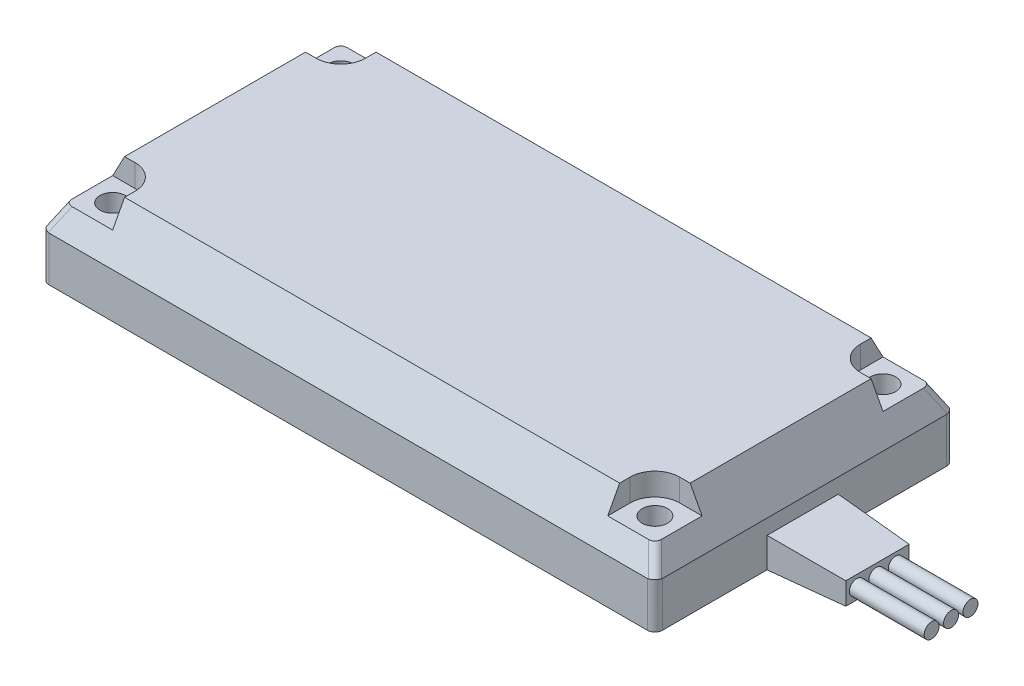
from build123d import *
from OCP.BRepFilletAPI import BRepFilletAPI_MakeChamfer

# Parameters (mm, degrees)
SKETCH1_W           = 41
SKETCH1_H           = 20
BOSS_EXTRUDE1_DEPTH = 6
CHAMFER1_SIZE       = 3
CHAMFER1_SIZE2      = 1.595128295
BOSS_EXTRUDE2_DEPTH = 5
BOSS_EXTRUDE2_TAPER = 3
SKETCH3_R           = 0.5
BOSS_EXTRUDE3_DEPTH = 5
CUT_EXTRUDE3_DEPTH  = 1.5
SKETCH5_R           = 0.85
CUT_EXTRUDE4_DEPTH  = 55.965898527
FILLET1_R           = 0.5


with BuildPart() as part:
    # Sketch1 → Boss-Extrude1 (new body)
    with BuildSketch(Plane(origin=(0, 0, 0), x_dir=(1, 0, 0), z_dir=(0, 1, 0))):
        with Locations((20.5, 10)):
            Rectangle(SKETCH1_W, SKETCH1_H)
    extrude(amount=BOSS_EXTRUDE1_DEPTH)

    # Chamfer1: one chamfer whose edges measure the first distance from different faces: ONE call of the kernel's chamfer builder (chamfer() names one face for all edges)
    chamfer1_edges_1 = [part.edges().sort_by_distance(p)[0] for p in [
        (41, 6, -10),
    ]]
    chamfer1_side_1 = [part.faces().sort_by_distance(p)[0] for p in [
        (41, 3, -10),
    ]]
    chamfer1_edges_2 = [part.edges().sort_by_distance(p)[0] for p in [
        (20.5, 6, -20),
    ]]
    chamfer1_side_2 = [part.faces().sort_by_distance(p)[0] for p in [
        (20.5, 3, -20),
    ]]
    chamfer1_edges_3 = [part.edges().sort_by_distance(p)[0] for p in [
        (0, 6, -10),
    ]]
    chamfer1_side_3 = [part.faces().sort_by_distance(p)[0] for p in [
        (0, 3, -10),
    ]]
    chamfer1_edges_4 = [part.edges().sort_by_distance(p)[0] for p in [
        (20.5, 6, 0),
    ]]
    chamfer1_side_4 = [part.faces().sort_by_distance(p)[0] for p in [
        (20.5, 3, 0),
    ]]
    chamfer1 = BRepFilletAPI_MakeChamfer(part.part.solid().wrapped)
    for e in chamfer1_edges_1:
        chamfer1.Add(CHAMFER1_SIZE, CHAMFER1_SIZE2, e.wrapped, chamfer1_side_1[0].wrapped)  # the first distance lies on this face
    for e in chamfer1_edges_2:
        chamfer1.Add(CHAMFER1_SIZE, CHAMFER1_SIZE2, e.wrapped, chamfer1_side_2[0].wrapped)  # the first distance lies on this face
    for e in chamfer1_edges_3:
        chamfer1.Add(CHAMFER1_SIZE, CHAMFER1_SIZE2, e.wrapped, chamfer1_side_3[0].wrapped)  # the first distance lies on this face
    for e in chamfer1_edges_4:
        chamfer1.Add(CHAMFER1_SIZE, CHAMFER1_SIZE2, e.wrapped, chamfer1_side_4[0].wrapped)  # the first distance lies on this face
    add(Compound.cast(chamfer1.Shape()), mode=Mode.REPLACE)

    # Sketch2 → Boss-Extrude2 (add)
    with BuildSketch(Plane(origin=(41, 0, 0), x_dir=(0, 0, -1), z_dir=(1, 0, 0))):
        Polygon((10, 2), (7.5, 2), (7.5, 0), (12.260148274, 0), (12.260148274, 2), align=None)
    extrude(amount=BOSS_EXTRUDE2_DEPTH, taper=BOSS_EXTRUDE2_TAPER)

    # Sketch3 → Boss-Extrude3 (add)
    with BuildSketch(Plane(origin=(46, 0, 0), x_dir=(0, 0, -1), z_dir=(1, 0, 0))):
        with Locations((8.5, 1)):
            Circle(SKETCH3_R)
        with Locations((9.8, 1)):
            Circle(SKETCH3_R)
        with Locations((11.1, 1)):
            Circle(SKETCH3_R)
    extrude(amount=BOSS_EXTRUDE3_DEPTH)

    # Sketch4 → Cut-Extrude3 (cut)
    with BuildSketch(Plane(origin=(0, 6, 0), x_dir=(1, 0, 0), z_dir=(0, 1, 0))):
        with BuildLine():
            Line((38.697764924, 0.652235076), (37.047764924, 0.652235076))
            Line((37.047764924, 0.652235076), (37.047764924, 2.302235076))
            ThreePointArc((37.047764924, 2.302235076), (37.531038735, 3.468961265), (38.697764924, 3.952235076))
            Line((38.697764924, 3.952235076), (40.347764924, 3.952235076))
            Line((40.347764924, 3.952235076), (40.347764924, 2.302235076))
            Line((40.347764924, 2.302235076), (40.347764924, 0.652235076))
            Line((40.347764924, 0.652235076), (38.697764924, 0.652235076))
        make_face()
        with BuildLine():
            Line((37.047764924, 17.697764924), (37.047764924, 19.347764924))
            Line((37.047764924, 19.347764924), (38.697764924, 19.347764924))
            Line((38.697764924, 19.347764924), (40.347764924, 19.347764924))
            Line((40.347764924, 19.347764924), (40.347764924, 17.697764924))
            Line((40.347764924, 17.697764924), (40.347764924, 16.047764924))
            Line((40.347764924, 16.047764924), (38.697764924, 16.047764924))
            ThreePointArc((38.697764924, 16.047764924), (37.531038735, 16.531038735), (37.047764924, 17.697764924))
        make_face()
        with BuildLine():
            Line((2.302235076, 16.047764924), (0.652235076, 16.047764924))
            Line((0.652235076, 16.047764924), (0.652235076, 17.697764924))
            Line((0.652235076, 17.697764924), (0.652235076, 19.347764924))
            Line((0.652235076, 19.347764924), (2.302235076, 19.347764924))
            Line((2.302235076, 19.347764924), (3.952235076, 19.347764924))
            Line((3.952235076, 19.347764924), (3.952235076, 17.697764924))
            ThreePointArc((3.952235076, 17.697764924), (3.468961265, 16.531038735), (2.302235076, 16.047764924))
        make_face()
        with BuildLine():
            Line((3.952235076, 2.302235076), (3.952235076, 0.652235076))
            Line((3.952235076, 0.652235076), (2.302235076, 0.652235076))
            Line((2.302235076, 0.652235076), (0.652235076, 0.652235076))
            Line((0.652235076, 0.652235076), (0.652235076, 2.302235076))
            Line((0.652235076, 2.302235076), (0.652235076, 3.952235076))
            Line((0.652235076, 3.952235076), (2.302235076, 3.952235076))
            ThreePointArc((2.302235076, 3.952235076), (3.468961265, 3.468961265), (3.952235076, 2.302235076))
        make_face()
    extrude(amount=-CUT_EXTRUDE3_DEPTH, mode=Mode.SUBTRACT)

    # Sketch5 → Cut-Extrude4 (cut, through all)
    with BuildSketch(Plane(origin=(0, 4.5, 0), x_dir=(1, 0, 0), z_dir=(0, 1, 0))):
        with Locations(Location((38.625100388, 2.374899612, 0), (0, 0, 270))):
            Circle(SKETCH5_R)
        with Locations(Location((38.625100388, 17.625100388, 0), (0, 0, 270))):
            Circle(SKETCH5_R)
        with Locations(Location((2.374899612, 17.625100388, 0), (0, 0, 270))):
            Circle(SKETCH5_R)
        with Locations(Location((2.374899612, 2.374899612, 0), (0, 0, 270))):
            Circle(SKETCH5_R)
    extrude(amount=-CUT_EXTRUDE4_DEPTH, mode=Mode.SUBTRACT)

    # Fillet1
    # the kernel refuses this fillet: 0.5 mm, written as the material it takes off along each edge
    with BuildSketch(Plane(origin=(-0.424571433, 2.20149727, -20.424571433), x_dir=(-0.19951100260176627, -0.3752256227209219, 0.9052077617290598), z_dir=(0.42496930254486104, 0.79925101425589, 0.42496930254486104)), Plane(origin=(-0.424571433, 2.20149727, 0.424571433), x_dir=(0.9052077617290598, -0.3752256227209218, 0.19951100260176646), z_dir=(0.42496930254486104, 0.79925101425589, -0.42496930254486104))) as fillet1_piece_1:
        with BuildLine():
            CenterArc((FILLET1_R * 0.799251014256, FILLET1_R), FILLET1_R, 192.732736423, 77.267263577)
            Line((-FILLET1_R * 0.176157759496, FILLET1_R * 0.779596451735), (0, 0))
            Line((0, 0), (FILLET1_R * 0.799251014256, 0))
        make_face()
    extrude(amount=3.874884616, mode=Mode.SUBTRACT)
    with BuildSketch(Plane(origin=(0, -1.25, -20), x_dir=(0, 0, 1), z_dir=(0, 1, 0)), Plane(origin=(0, -1.25, 0), x_dir=(1, 0, 0), z_dir=(0, 1, 0))) as fillet1_piece_2:
        with BuildLine():
            CenterArc((FILLET1_R, FILLET1_R), FILLET1_R, 180, 90)
            Line((0, FILLET1_R), (0, 0))
            Line((0, 0), (FILLET1_R, 0))
        make_face()
    extrude(amount=5.5, mode=Mode.SUBTRACT)
    with BuildSketch(Plane(origin=(41.424571433, 2.20149727, 0.424571433), x_dir=(-0.9052077617290598, -0.37522562272092175, 0.1995110026017665), z_dir=(-0.42496930254486104, 0.79925101425589, -0.42496930254486104)), Plane(origin=(41.424571433, 2.20149727, -20.424571433), x_dir=(0.1995110026017654, -0.37522562272092236, 0.9052077617290599), z_dir=(-0.42496930254486104, 0.79925101425589, 0.42496930254486104))) as fillet1_piece_3:
        with BuildLine():
            CenterArc((FILLET1_R * 0.799251014256, -FILLET1_R), FILLET1_R, 90, 77.267263577)
            Line((-FILLET1_R * 0.176157759496, -FILLET1_R * 0.779596451735), (0, 0))
            Line((0, 0), (FILLET1_R * 0.799251014256, 0))
        make_face()
    extrude(amount=3.874884616, mode=Mode.SUBTRACT)
    with BuildSketch(Plane(origin=(41, -1.25, -20), x_dir=(0, 0, 1), z_dir=(0, 1, 0)), Plane(origin=(41, -1.25, 0), x_dir=(-1, 0, 0), z_dir=(0, 1, 0))) as fillet1_piece_4:
        with BuildLine():
            CenterArc((FILLET1_R, -FILLET1_R), FILLET1_R, 90, 90)
            Line((0, -FILLET1_R), (0, 0))
            Line((0, 0), (FILLET1_R, 0))
        make_face()
    extrude(amount=5.5, mode=Mode.SUBTRACT)


solid = part.part
